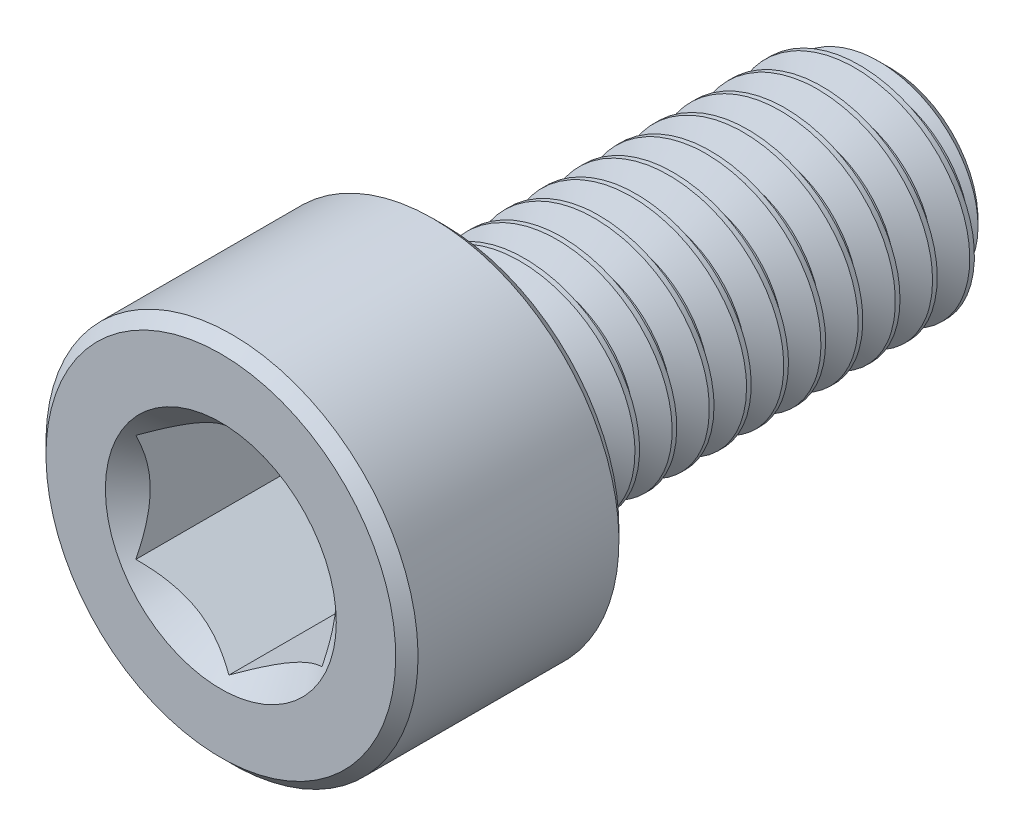
from build123d import *

# Parameters (mm, degrees)
CUT_EXTRUDE1_DEPTH     = 5
SKETCH4_R              = 3.103257697
CUT_EXTRUDE2_DEPTH     = 3
CUT_EXTRUDE2_DRAFT     = -45
SPLIT1_SURFACE_1_BACK  = 23.891
SPLIT1_SURFACE_1_DEPTH = 47.782
SPLIT1_SURFACE_2_BACK  = 23.891
SPLIT1_SURFACE_2_DEPTH = 47.782
CUT_SWEEP1_PITCH       = 1


with BuildPart() as part:
    # Sketch2 → Revolve1 (revolve)
    with BuildSketch(Plane(origin=(0, 0, 0), x_dir=(0, 0, -1), z_dir=(1, 0, 0))):
        with BuildLine():
            Line((-9, 0), (-9, 4.7))
            Line((-9, 4.7), (-8.7, 5))
            Line((-8.7, 5), (-3.3, 5))
            Line((-3.3, 5), (-3, 4.7))
            Line((-3, 4.7), (-3, 3.3))
            ThreePointArc((-3, 3.3), (-2.912132034, 3.087867966), (-2.7, 3))
            Line((-2.7, 3), (8.350480947, 3))
            Line((8.350480947, 3), (9, 2.350480947))
            Line((9, 2.350480947), (9, 0))
            Line((9, 0), (-9, 0))
        make_face()
    revolve(axis=Axis((0, 0, -9), (0, 0, 1)))

    # Sketch3 → Cut-Extrude1 (cut)
    with BuildSketch(Plane.XY.offset(9)):
        Polygon((2.5, -1.443375673), (2.5, 1.443375673), (0, 2.886751346), (-2.5, 1.443375673), (-2.5, -1.443375673), (0, -2.886751346), align=None)
    extrude(amount=-CUT_EXTRUDE1_DEPTH, mode=Mode.SUBTRACT)


with BuildPart() as cut_extrude2_tool:
    # Sketch4 → Cut-Extrude2 (with draft: the straight prism first)
    with BuildSketch(Plane.XY.offset(9)):
        Circle(SKETCH4_R)
    extrude(amount=-CUT_EXTRUDE2_DEPTH)
    # Cut-Extrude2: the draft: its side faces are tilted about the plane it starts from
    cut_extrude2_sides = [cut_extrude2_tool.faces().sort_by_distance(p)[0] for p in [
        (-3.103257697, 0, 7.5),
    ]]
    draft(cut_extrude2_sides, Plane.XY.offset(9), CUT_EXTRUDE2_DRAFT)


with BuildPart() as part_1:
    add(part.part)

    # Cut-Extrude2: cut by cut_extrude2_tool
    add(cut_extrude2_tool.part, mode=Mode.SUBTRACT)


with BuildPart() as body_2:
    # Split1: the piece behind the surface
    add(part_1.part)
    # Split1 surface: a surface, the sketch's curves swept straight by 47.782 mm
    with BuildLine(Plane(origin=(0, 0, 0), x_dir=(0, 0, -1), z_dir=(1, 0, 0)).offset(-SPLIT1_SURFACE_1_BACK), mode=Mode.PRIVATE) as split1_surface_1_path:
        Line((-2.7, -5), (-2.7, 5))
    split1_surface_1 = Shell.extrude(split1_surface_1_path.wire(), (1 * SPLIT1_SURFACE_1_DEPTH, 0 * SPLIT1_SURFACE_1_DEPTH, 0 * SPLIT1_SURFACE_1_DEPTH))
    split(bisect_by=split1_surface_1, keep=Keep.BOTTOM)

    # Cut-Sweep1: the profile of Sketch7 screwed along a right-hand helix of 13 turns, 8 arcs to a turn; built about Z, then put on its axis
    cut_sweep1_z = Axis((0, 0, 0), (0, 0, 1))
    cut_sweep1_corners = [(3.054126588, 0, 0.03125), (3.054126588, 0, -0.90625), (2.350480947, 0, -0.5), (2.350480947, 0, -0.375)]
    with BuildLine(mode=Mode.PRIVATE) as cut_sweep1_profile:
        Line(cut_sweep1_corners[0], cut_sweep1_corners[1])
        Line(cut_sweep1_corners[1], cut_sweep1_corners[2])
        Line(cut_sweep1_corners[2], cut_sweep1_corners[3])
        Line(cut_sweep1_corners[3], cut_sweep1_corners[0])
    cut_sweep1_cap = Face(cut_sweep1_profile.wire())
    cut_sweep1_turn_angles = [0, 22.5, 45, 67.5, 90, 112.5, 135, 157.5, 180, 202.5, 225, 247.5, 270, 292.5, 315, 337.5, 360]
    cut_sweep1_turn_weights = [1, 0.9238795325112867, 1, 0.9238795325112867, 1, 0.9238795325112867, 1, 0.9238795325112867, 1, 0.9238795325112867, 1, 0.9238795325112867, 1, 0.9238795325112867, 1, 0.9238795325112867, 1]
    cut_sweep1_turn_rails = [Edge.make_bspline([Vector(p[0], p[1], 0).rotate(cut_sweep1_z, cut_sweep1_turn_angles[k]) / cut_sweep1_turn_weights[k] + Vector(0, 0, p[2] + CUT_SWEEP1_PITCH * cut_sweep1_turn_angles[k] / 360) for k in range(17)], [0, 0, 0, 1, 1, 2, 2, 3, 3, 4, 4, 5, 5, 6, 6, 7, 7, 8, 8, 8], 2, cut_sweep1_turn_weights) for p in cut_sweep1_corners]
    cut_sweep1_turn_sides = [Face.make_surface_from_curves(cut_sweep1_turn_rails[p[0]], cut_sweep1_turn_rails[p[1]]) for p in [(0, 1), (1, 2), (2, 3), (3, 0)]]
    cut_sweep1 = Plane(origin=(0, 0, -9), x_dir=(0, 1, 0), z_dir=(0, 0, 1)) * Solid(Shell([*[p.moved(Location((0, 0, CUT_SWEEP1_PITCH * i))) for i in range(13) for p in cut_sweep1_turn_sides], cut_sweep1_cap, cut_sweep1_cap.rotate(cut_sweep1_z, 4680).moved(Location((0, 0, CUT_SWEEP1_PITCH * 4680 / 360)))]))
    add(cut_sweep1, mode=Mode.SUBTRACT)


with BuildPart() as part_2:
    add(part_1.part)

    # Split1: split by a surface, the side it looks to stays
    # Split1 surface: a surface, the sketch's curves swept straight by 47.782 mm
    with BuildLine(Plane(origin=(0, 0, 0), x_dir=(0, 0, -1), z_dir=(1, 0, 0)).offset(-SPLIT1_SURFACE_2_BACK), mode=Mode.PRIVATE) as split1_surface_2_path:
        Line((-2.7, -5), (-2.7, 5))
    split1_surface_2 = Shell.extrude(split1_surface_2_path.wire(), (1 * SPLIT1_SURFACE_2_DEPTH, 0 * SPLIT1_SURFACE_2_DEPTH, 0 * SPLIT1_SURFACE_2_DEPTH))
    split(bisect_by=split1_surface_2, keep=Keep.TOP)

    add(body_2.part)  # Revolve2 merges body 2
    # Sketch8 → Revolve2 (revolve)
    with BuildSketch(Plane(origin=(0, 0, 0), x_dir=(0, 0, -1), z_dir=(1, 0, 0))):
        Polygon((-3, 0), (-3, 3), (-2.7, 3), (-0.967949192, 0), align=None)
    revolve(axis=Axis((0, 0, 0.967949192), (0, 0, 1)))


solid = part_2.part
